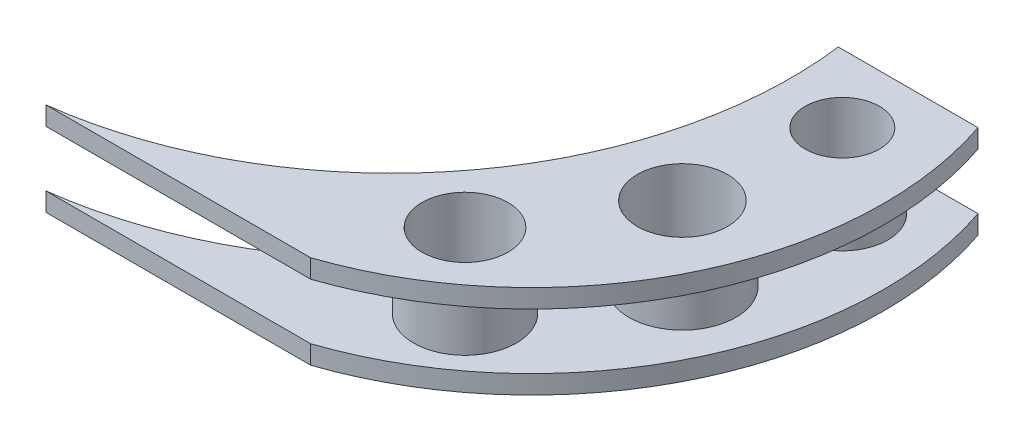
from build123d import *

# Parameters (mm, degrees)
BOSS_EXTRUDE1_DEPTH = 8.466666667
SKETCH2_R           = 16.885394085
SKETCH2_R_2         = 20.512287495
SKETCH2_R_3         = 19.572941721
CUT_EXTRUDE3_DEPTH  = 304.774506345
BOSS_EXTRUDE2_START = 12.7
SKETCH2_4_R         = 20.695394085
SKETCH2_4_R_2       = 16.885394085
SKETCH2_4_R_3       = 24.322287495
SKETCH2_4_R_4       = 20.512287495
SKETCH2_4_R_5       = 23.382941721
SKETCH2_4_R_6       = 19.572941721
BOSS_EXTRUDE2_DEPTH = 12.7


with BuildPart() as part:
    # Sketch1 → Boss-Extrude1 (new body)
    with BuildSketch(Plane(origin=(0, 0, 0), x_dir=(1, 0, 0), z_dir=(0, 1, 0))):
        with BuildLine():
            Line((164.261221292, 12.021360676), (227.761221292, 12.021360676))
            ThreePointArc((227.761221292, 12.021360676), (219.55639394, -110.223196762), (127.314749355, -190.861463232))
            Line((127.314749355, -190.861463232), (6.974690834, -190.861455535))
            ThreePointArc((6.974690834, -190.861455535), (127.636363086, -121.995154476), (164.261221292, 12.021360676))
        make_face()
    boss_extrude1 = extrude(amount=BOSS_EXTRUDE1_DEPTH)

    # Sketch2 → Cut-Extrude3 (cut, through all)
    with BuildSketch(Plane(origin=(0, 8.466666667, 0), x_dir=(1, 0, 0), z_dir=(0, 1, 0))):
        with Locations((196.950964228, -18.851615567)):
            Circle(SKETCH2_R)
        with Locations((189.259581589, -83.843798865)):
            Circle(SKETCH2_R_2)
        with Locations((150.418099263, -143.836583448)):
            Circle(SKETCH2_R_3)
    cut_extrude3 = extrude(amount=-CUT_EXTRUDE3_DEPTH, mode=Mode.SUBTRACT)

    # Sketch2<4> → Boss-Extrude2 (add)
    # profile 1 of 3: a face of its own
    with BuildSketch(Plane(origin=(0, 8.466666667, 0), x_dir=(1, 0, 0), z_dir=(0, 1, 0)).offset(BOSS_EXTRUDE2_START)):
        with Locations((196.950964228, -18.851615567)):
            Circle(SKETCH2_4_R)
        with Locations((196.950964228, -18.851615567)):
            Circle(SKETCH2_4_R_2, mode=Mode.SUBTRACT)
    # profile 2 of 3: a face of its own
    with BuildSketch(Plane(origin=(0, 8.466666667, 0), x_dir=(1, 0, 0), z_dir=(0, 1, 0)).offset(BOSS_EXTRUDE2_START)):
        with Locations((189.259581589, -83.843798865)):
            Circle(SKETCH2_4_R_3)
        with Locations((189.259581589, -83.843798865)):
            Circle(SKETCH2_4_R_4, mode=Mode.SUBTRACT)
    # profile 3 of 3: a face of its own
    with BuildSketch(Plane(origin=(0, 8.466666667, 0), x_dir=(1, 0, 0), z_dir=(0, 1, 0)).offset(BOSS_EXTRUDE2_START)):
        with Locations((150.418099263, -143.836583448)):
            Circle(SKETCH2_4_R_5)
        with Locations((150.418099263, -143.836583448)):
            Circle(SKETCH2_4_R_6, mode=Mode.SUBTRACT)
    boss_extrude2 = extrude(amount=-BOSS_EXTRUDE2_DEPTH)

    # Mirror3: Boss-Extrude1, Cut-Extrude3, Boss-Extrude2 across plane
    add(boss_extrude1.mirror(Plane.ZX.offset(21.166666667)))
    add(cut_extrude3.mirror(Plane.ZX.offset(21.166666667)), mode=Mode.SUBTRACT)
    add(boss_extrude2.mirror(Plane.ZX.offset(21.166666667)))


solid = part.part
